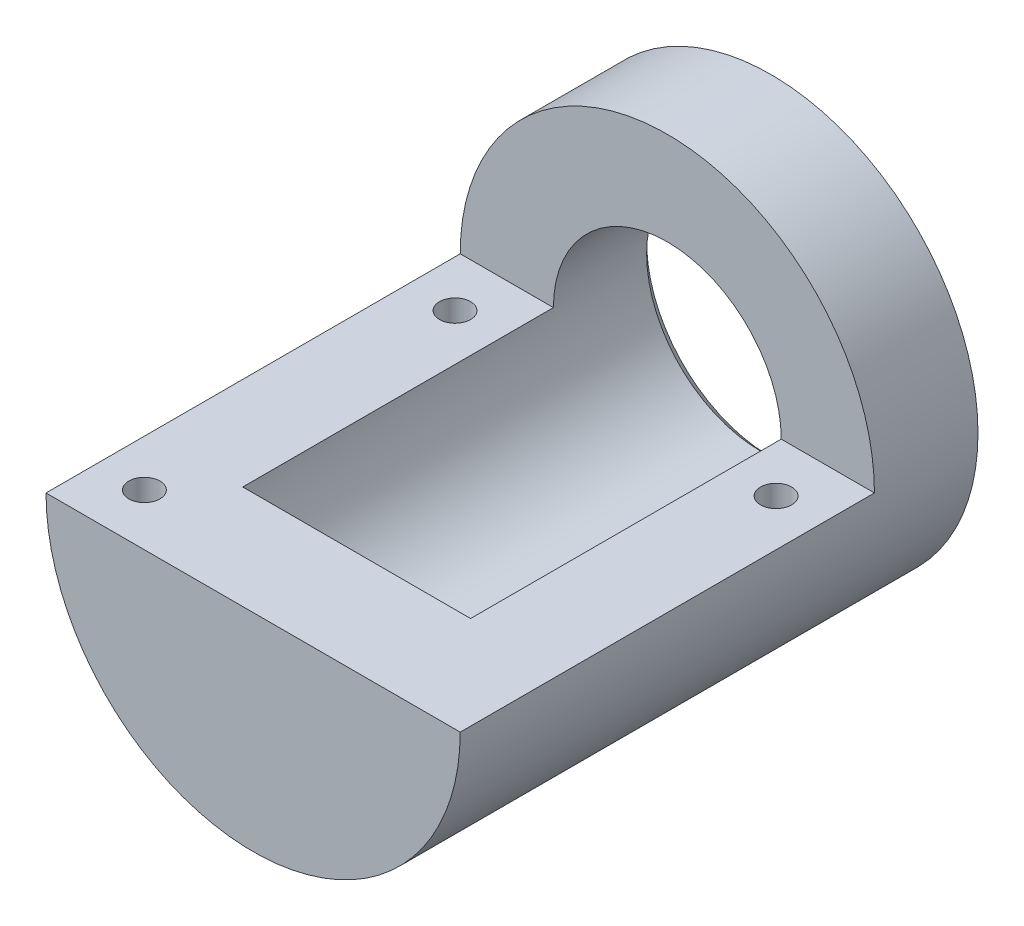
from build123d import *

# Parameters (mm, degrees)
SKETCH1_R           = 20
SKETCH1_R_2         = 11
BOSS_EXTRUDE1_DEPTH = 10
BOSS_EXTRUDE3_DEPTH = 40
BOSS_EXTRUDE4_START = -10
BOSS_EXTRUDE4_DEPTH = 10
CHAMFER2_SIZE       = 1
SKETCH4_R           = 1.5
CUT_EXTRUDE1_DEPTH  = 8


with BuildPart() as part:
    # Sketch1 → Boss-Extrude1 (new body)
    with BuildSketch(Plane.XY):
        Circle(SKETCH1_R)
        Circle(SKETCH1_R_2, mode=Mode.SUBTRACT)
    extrude(amount=BOSS_EXTRUDE1_DEPTH)

    # Sketch2 → Boss-Extrude3 (add)
    with BuildSketch(Plane.XY.offset(10)):
        with BuildLine():
            Line((-20, 0), (-11, 0))
            ThreePointArc((-11, 0), (0, -11), (11, 0))
            Line((11, 0), (20, 0))
            ThreePointArc((20, 0), (0, -20), (-20, 0))
        make_face()
    extrude(amount=BOSS_EXTRUDE3_DEPTH)

    # Sketch3 → Boss-Extrude4 (add)
    with BuildSketch(Plane.XY.offset(50).offset(BOSS_EXTRUDE4_START)):
        with BuildLine():
            Line((-20, 0), (20, 0))
            ThreePointArc((20, 0), (0, -20), (-20, 0))
        make_face()
    extrude(amount=BOSS_EXTRUDE4_DEPTH)

    # Chamfer2
    chamfer2_edges = [part.edges().sort_by_distance(p)[0] for p in [
        (-11, 0, 0),
    ]]
    chamfer(chamfer2_edges, length=CHAMFER2_SIZE)

    # Sketch4 → Cut-Extrude1 (cut)
    with BuildSketch(Plane(origin=(0, 0, 0), x_dir=(1, 0, 0), z_dir=(0, 1, 0))):
        with Locations((-15.5, -15)):
            Circle(SKETCH4_R)
        with Locations((15.5, -15)):
            Circle(SKETCH4_R)
        with Locations((-15.5, -45)):
            Circle(SKETCH4_R)
    extrude(amount=-CUT_EXTRUDE1_DEPTH, mode=Mode.SUBTRACT)


solid = part.part
